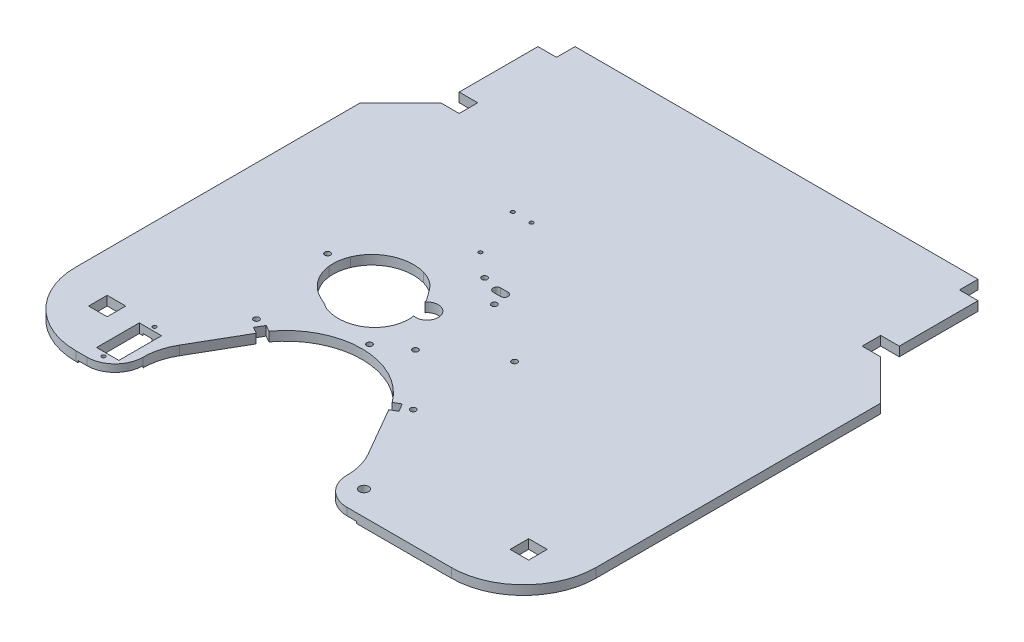
from build123d import *

# Parameters (mm, degrees)
ESQUISSE1_W              = 280.2
ESQUISSE1_H              = 276.282873123
BOSS_EXTRU_1_DEPTH       = 5
ESQUISSE2_R              = 1.5
ENL_V_MAT_EXTRU_2_DEPTH  = 283.344868376
ENL_V_MAT_EXTRU_3_DEPTH  = 283.344868376
ESQUISSE4_R              = 1
ENL_V_MAT_EXTRU_4_DEPTH  = 283.344868514
ESQUISSE5_R              = 1.5
ENL_V_MAT_EXTRU_5_DEPTH  = 283.344868514
ESQUISSE6_R              = 6
ENL_V_MAT_EXTRU_6_DEPTH  = 283.344868514
ENL_V_MAT_EXTRU_7_DEPTH  = 283.344868514
ENL_V_MAT_EXTRU_8_DEPTH  = 283.344868514
ENL_V_MAT_EXTRU_9_DEPTH  = 283.344868514
ENL_V_MAT_EXTRU_10_DEPTH = 1
ESQUISSE11_W             = 10
ESQUISSE11_H             = 10
ENL_V_MAT_EXTRU_11_DEPTH = 283.344868514
ESQUISSE12_R             = 2.5
ESQUISSE12_R_2           = 1
ESQUISSE12_W             = 12
ESQUISSE12_H             = 23
ENL_V_MAT_EXTRU_12_DEPTH = 283.344868514


with BuildPart() as part:
    # Esquisse1 → Boss.-Extru.1 (new body)
    with BuildSketch(Plane(origin=(0, 0, 0), x_dir=(1, 0, 0), z_dir=(0, 1, 0))):
        with Locations((0, -106.941436562)):
            Rectangle(ESQUISSE1_W, ESQUISSE1_H)
    extrude(amount=BOSS_EXTRU_1_DEPTH)

    # Esquisse2 → Enlèv. mat.-Extru.2 (cut, through all)
    with BuildSketch(Plane(origin=(0, 0, 0), x_dir=(1, 0, 0), z_dir=(0, 1, 0))):
        with Locations((-67.225778058, -181.665063509)):
            Circle(ESQUISSE2_R)
        with Locations((17.225778058, -181.665063509)):
            Circle(ESQUISSE2_R)
        with BuildLine():
            Line((-58.181549424, -184), (-61.645651039, -182))
            Line((-61.645651039, -182), (-64.145651039, -186.330127019))
            Line((-64.145651039, -186.330127019), (-60.681549424, -188.330127019))
            Line((-60.681549424, -188.330127019), (-75.853895909, -214.609402001))
            ThreePointArc((-75.853895909, -214.609402001), (-78.945508514, -222.073215083), (-80, -230.082873123))
            ThreePointArc((-80, -230.082873123), (-84.393398282, -240.68947484), (-95, -245.082873123))
            Line((-95, -245.082873123), (45, -245.082873123))
            ThreePointArc((45, -245.082873123), (34.393398282, -240.68947484), (30, -230.082873123))
            ThreePointArc((30, -230.082873123), (28.945508514, -222.073215083), (25.853895909, -214.609402001))
            Line((25.853895909, -214.609402001), (10.681549424, -188.330127019))
            Line((10.681549424, -188.330127019), (14.145651039, -186.330127019))
            Line((14.145651039, -186.330127019), (11.645651039, -182))
            Line((11.645651039, -182), (8.181549424, -184))
            ThreePointArc((8.181549424, -184), (-25, -167.082873123), (-58.181549424, -184))
        make_face()
    extrude(amount=ENL_V_MAT_EXTRU_2_DEPTH, mode=Mode.SUBTRACT)

    # Esquisse3 → Enlèv. mat.-Extru.3 (cut, through all)
    with BuildSketch(Plane(origin=(0, 5, 0), x_dir=(1, 0, 0), z_dir=(0, 1, 0))):
        with BuildLine():
            Line((-30.232196293, -127.056876517), (-26.124706917, -139.131217425))
            add(Edge.make_bspline(
                [(-26.124706917, -139.131217425), (-25.973443286, -141.562315427), (-26.240501714, -144.066449507), (-26.974458359, -146.389039833)],
                knots=[0, 0, 0, 0, 1, 1, 1, 1], degree=3))
            add(Edge.make_bspline(
                [(-26.974458359, -146.389039833), (-27.240939918, -147.232315109), (-27.901711614, -148.887186594), (-29.222092456, -151.16859082), (-30.896145941, -153.271950606), (-32.173925278, -154.467879681), (-32.85436264, -155.020953925)],
                knots=[0, 0, 0, 0, 0.25, 0.5, 0.75, 1, 1, 1, 1], degree=3))
            add(Edge.make_bspline(
                [(-32.85436264, -155.020953925), (-34.102216947, -156.035236967), (-36.895257319, -157.732816873), (-39.966969366, -158.683613706), (-41.535872906, -158.982350321)],
                knots=[0, 0, 0, 0, 0.5, 1, 1, 1, 1], degree=3))
            add(Edge.make_bspline(
                [(-41.535872906, -158.982350321), (-44.13944429, -159.478099156), (-46.882867983, -159.47574722), (-49.48692049, -158.982531853)],
                knots=[0, 0, 0, 0, 1, 1, 1, 1], degree=3))
            add(Edge.make_bspline(
                [(-49.48692049, -158.982531853), (-49.973436213, -158.890384314), (-50.941516847, -158.671807697), (-52.005577298, -158.352188131), (-52.710739171, -158.106116095), (-53.049063692, -157.981027978), (-53.432325993, -157.83427396), (-53.839616411, -157.629085383), (-54.162137671, -157.444280488), (-54.493584438, -157.24405871), (-54.822631153, -157.027085358), (-55.019194439, -156.890401704), (-55.119773387, -156.820266925)],
                knots=[0, 0, 0, 0, 0.25, 0.5, 0.5625, 0.625, 0.6875, 0.75, 0.8125, 0.875, 0.9375, 1, 1, 1, 1], degree=3))
            add(Edge.make_bspline(
                [(-55.119773387, -156.820266925), (-55.342584678, -156.664898224), (-55.821161133, -156.320773011), (-56.357830194, -156.028764531), (-57.135810805, -155.694321533), (-58.127753562, -155.272422312), (-59.441462171, -154.713730904), (-60.715247509, -154.070015017), (-61.736091579, -153.463400683), (-62.671055675, -152.853125374), (-64.3254583, -151.704430932), (-66.461253558, -149.797913164), (-68.688909234, -147.123366593), (-71.04573381, -143.184617989), (-72.065572969, -139.797016013), (-72.336044542, -137.516218816)],
                knots=[0, 0, 0, 0, 0.03125, 0.0625, 0.09375, 0.125, 0.1875, 0.25, 0.28125, 0.3125, 0.375, 0.5, 0.625, 0.75, 1, 1, 1, 1], degree=3))
            add(Edge.make_bspline(
                [(-72.336044542, -137.516218816), (-72.538851292, -135.806016663), (-72.497059046, -132.31446777), (-71.577583293, -128.96502082), (-70.925114795, -127.375270768)],
                knots=[0, 0, 0, 0, 0.5, 1, 1, 1, 1], degree=3))
            add(Edge.make_bspline(
                [(-70.925114795, -127.375270768), (-70.413093619, -126.127722888), (-69.152455528, -123.733716988), (-66.576150351, -120.520293649), (-63.491201583, -117.918915096), (-59.929943003, -115.889711454), (-56.128151034, -114.553617023), (-52.09810731, -113.890404675), (-48.046815493, -113.938774256), (-45.377232563, -114.445148274), (-44.081266578, -114.817883607)],
                knots=[0, 0, 0, 0, 0.125, 0.25, 0.375, 0.5, 0.625, 0.75, 0.875, 1, 1, 1, 1], degree=3))
            add(Edge.make_bspline(
                [(-44.081266578, -114.817883607), (-43.14238246, -115.087917919), (-41.310567547, -115.747973194), (-39.103484983, -116.93355719), (-37.482075864, -118.081051527), (-36.310697029, -119.096824351), (-35.307582377, -120.188793074), (-34.695859436, -120.936019919), (-34.39519288, -121.317167086)],
                knots=[0, 0, 0, 0, 0.25, 0.5, 0.625, 0.75, 0.875, 1, 1, 1, 1], degree=3))
            add(Edge.make_bspline(
                [(-34.39519288, -121.317167086), (-33.6647314, -122.243154093), (-32.610141308, -123.682254904), (-31.253536633, -125.564961028), (-30.556455375, -126.553796492), (-30.232196293, -127.056876517)],
                knots=[0, 0, 0, 0, 0.5, 0.75, 1, 1, 1, 1], degree=3))
        make_face()
    extrude(amount=-ENL_V_MAT_EXTRU_3_DEPTH, mode=Mode.SUBTRACT)

    # Esquisse4 → Enlèv. mat.-Extru.4 (cut, through all)
    with BuildSketch(Plane(origin=(0, 5, 0), x_dir=(1, 0, 0), z_dir=(0, 1, 0))):
        with Locations((-48.2, -62.65)):
            Circle(ESQUISSE4_R)
        with Locations((-38.1, -62.65)):
            Circle(ESQUISSE4_R)
        with Locations((-38.1, -90.25)):
            Circle(ESQUISSE4_R)
    extrude(amount=-ENL_V_MAT_EXTRU_4_DEPTH, mode=Mode.SUBTRACT)

    # Esquisse5 → Enlèv. mat.-Extru.5 (cut, through all)
    with BuildSketch(Plane(origin=(0, 5, 0), x_dir=(1, 0, 0), z_dir=(0, 1, 0))):
        with Locations((22.122359024, -132)):
            Circle(ESQUISSE5_R)
        with Locations((-10.050791121, -153.25)):
            Circle(ESQUISSE5_R)
        with Locations((-25, -163)):
            Circle(ESQUISSE5_R)
        with Locations((-10.050791121, -110.75)):
            Circle(ESQUISSE5_R)
        with Locations((-25, -101)):
            Circle(ESQUISSE5_R)
        with Locations((-78.6, -132)):
            Circle(ESQUISSE5_R)
    extrude(amount=-ENL_V_MAT_EXTRU_5_DEPTH, mode=Mode.SUBTRACT)

    # Esquisse6 → Enlèv. mat.-Extru.6 (cut, through all)
    with BuildSketch(Plane(origin=(0, 5, 0), x_dir=(1, 0, 0), z_dir=(0, 1, 0))):
        with Locations((-25, -132)):
            Circle(ESQUISSE6_R)
    extrude(amount=-ENL_V_MAT_EXTRU_6_DEPTH, mode=Mode.SUBTRACT)

    # Esquisse7 → Enlèv. mat.-Extru.7 (cut, through all)
    with BuildSketch(Plane(origin=(0, 5, 0), x_dir=(1, 0, 0), z_dir=(0, 1, 0))):
        with BuildLine():
            Line((-16, -101.4), (-12, -101.4))
            ThreePointArc((-12, -101.4), (-10, -103.4), (-12, -105.4))
            Line((-12, -105.4), (-16, -105.4))
            ThreePointArc((-16, -105.4), (-18, -103.4), (-16, -101.4))
        make_face()
    extrude(amount=-ENL_V_MAT_EXTRU_7_DEPTH, mode=Mode.SUBTRACT)

    # Esquisse8 → Enlèv. mat.-Extru.8 (cut, through all)
    with BuildSketch(Plane(origin=(0, 5, 0), x_dir=(1, 0, 0), z_dir=(0, 1, 0))):
        with BuildLine():
            Line((101.1, -245.082873123), (140.1, -245.082873123))
            Line((140.1, -245.082873123), (140.1, -206.082873123))
            ThreePointArc((140.1, -206.082873123), (128.677164466, -233.660037589), (101.1, -245.082873123))
        make_face()
        with BuildLine():
            Line((-140.1, -245.082873123), (-140.1, -206.082873123))
            ThreePointArc((-140.1, -206.082873123), (-128.677164466, -233.660037589), (-101.1, -245.082873123))
            Line((-101.1, -245.082873123), (-140.1, -245.082873123))
        make_face()
    extrude(amount=-ENL_V_MAT_EXTRU_8_DEPTH, mode=Mode.SUBTRACT)

    # Esquisse9 → Enlèv. mat.-Extru.9 (cut, through all)
    with BuildSketch(Plane(origin=(0, 5, 0), x_dir=(1, 0, 0), z_dir=(0, 1, 0))):
        Polygon((-108.5, 21.2), (-118.5, 21.2), (-118.5, -21.2), (-108.5, -21.2), (-108.5, -31.2), (-118.5, -31.2), (-140.1, -52.8), (-140.1, 31.2), (-108.5, 31.2), align=None)
        Polygon((140.1, 31.2), (108.5, 31.2), (108.5, 21.2), (118.5, 21.2), (118.5, -21.2), (108.5, -21.2), (108.5, -31.2), (118.5, -31.2), (140.1, -52.8), align=None)
    extrude(amount=-ENL_V_MAT_EXTRU_9_DEPTH, mode=Mode.SUBTRACT)

    # Esquisse10 → Enlèv. mat.-Extru.10 (cut)
    with BuildSketch(Plane.XZ):
        with BuildLine():
            Line((50, 242.082873123), (50, 245.082873123))
            Line((50, 245.082873123), (45, 245.082873123))
            ThreePointArc((45, 245.082873123), (30.714652713, 234.657679446), (36.286307054, 217.873386842))
            ThreePointArc((36.286307054, 217.873386842), (75.473609251, 99.823862194), (-25, 26.5))
            ThreePointArc((-25, 26.5), (-125.473609251, 99.823862194), (-86.286307054, 217.873386842))
            ThreePointArc((-86.286307054, 217.873386842), (-80.714652713, 234.657679446), (-95, 245.082873123))
            Line((-95, 245.082873123), (-100, 245.082873123))
            Line((-100, 245.082873123), (-100, 242.082873123))
            Line((-100, 242.082873123), (-95, 242.082873123))
            ThreePointArc((-95, 242.082873123), (-83.571722171, 233.742718181), (-88.029045643, 220.315284098))
            ThreePointArc((-88.029045643, 220.315284098), (-128.330678708, 98.90890093), (-25, 23.5))
            ThreePointArc((-25, 23.5), (78.330678708, 98.90890093), (38.029045643, 220.315284098))
            ThreePointArc((38.029045643, 220.315284098), (33.571722171, 233.742718181), (45, 242.082873123))
            Line((45, 242.082873123), (50, 242.082873123))
        make_face()
    extrude(amount=-ENL_V_MAT_EXTRU_10_DEPTH, mode=Mode.SUBTRACT)

    # Esquisse11 → Enlèv. mat.-Extru.11 (cut, through all)
    with BuildSketch(Plane(origin=(0, 5, 0), x_dir=(1, 0, 0), z_dir=(0, 1, 0))):
        with Locations((-113.5, -215.8)):
            Rectangle(ESQUISSE11_W, ESQUISSE11_H)
        with Locations((113.5, -215.8)):
            Rectangle(ESQUISSE11_W, ESQUISSE11_H)
    extrude(amount=-ENL_V_MAT_EXTRU_11_DEPTH, mode=Mode.SUBTRACT)

    # Esquisse12 → Enlèv. mat.-Extru.12 (cut, through all)
    with BuildSketch(Plane(origin=(0, 5, 0), x_dir=(1, 0, 0), z_dir=(0, 1, 0))):
        with Locations((41, -232)):
            Circle(ESQUISSE12_R)
        with Locations((-91, -212.75)):
            Circle(ESQUISSE12_R_2)
        with Locations((-91, -240.25)):
            Circle(ESQUISSE12_R_2)
        with Locations((-91, -226.5)):
            Rectangle(ESQUISSE12_W, ESQUISSE12_H)
    extrude(amount=-ENL_V_MAT_EXTRU_12_DEPTH, mode=Mode.SUBTRACT)


solid = part.part
